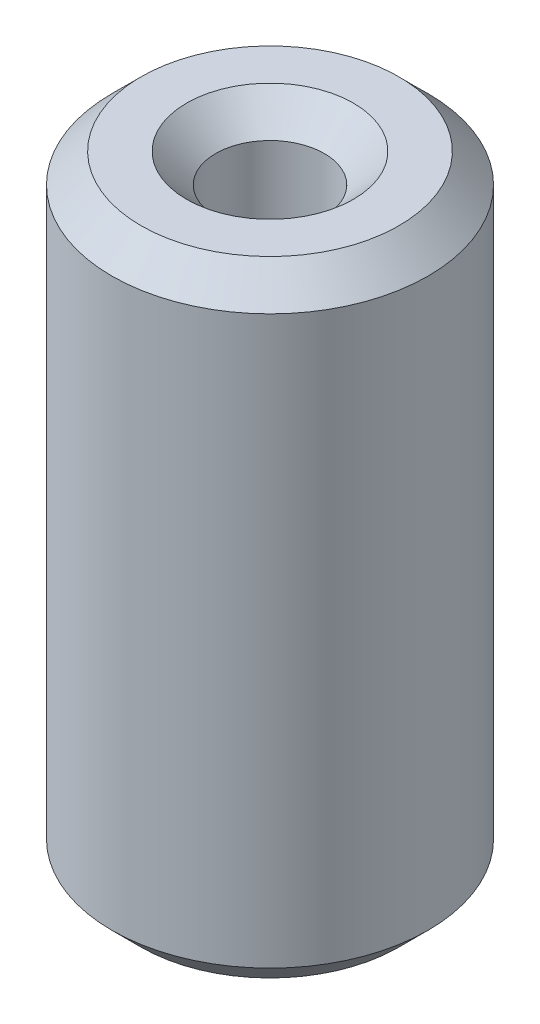
from build123d import *

# Parameters (mm, degrees)
SKETCH1_R           = 7.5
BOSS_EXTRUDE1_DEPTH = 29.645488072
SKETCH2_R           = 2.577201415
CUT_EXTRUDE1_DEPTH  = 32.485789859
CHAMFER1_SIZE       = 1.380374661


with BuildPart() as part:
    # Sketch1 → Boss-Extrude1 (new body)
    with BuildSketch(Plane(origin=(0, 0, 0), x_dir=(1, 0, 0), z_dir=(0, 1, 0))):
        Circle(SKETCH1_R)
    extrude(amount=BOSS_EXTRUDE1_DEPTH)

    # Sketch2 → Cut-Extrude1 (cut, through all)
    with BuildSketch(Plane(origin=(0, 0, 0), x_dir=(1, 0, 0), z_dir=(0, 1, 0))):
        Circle(SKETCH2_R)
    extrude(amount=CUT_EXTRUDE1_DEPTH, mode=Mode.SUBTRACT)

    # Chamfer1
    chamfer1_edges = [part.edges().sort_by_distance(p)[0] for p in [
        (-2.577201415, 29.645488072, 0),
        (-2.577201415, 0, 0),
        (-7.5, 0, 0),
        (-7.5, 29.645488072, 0),
    ]]
    chamfer(chamfer1_edges, length=CHAMFER1_SIZE)


solid = part.part
